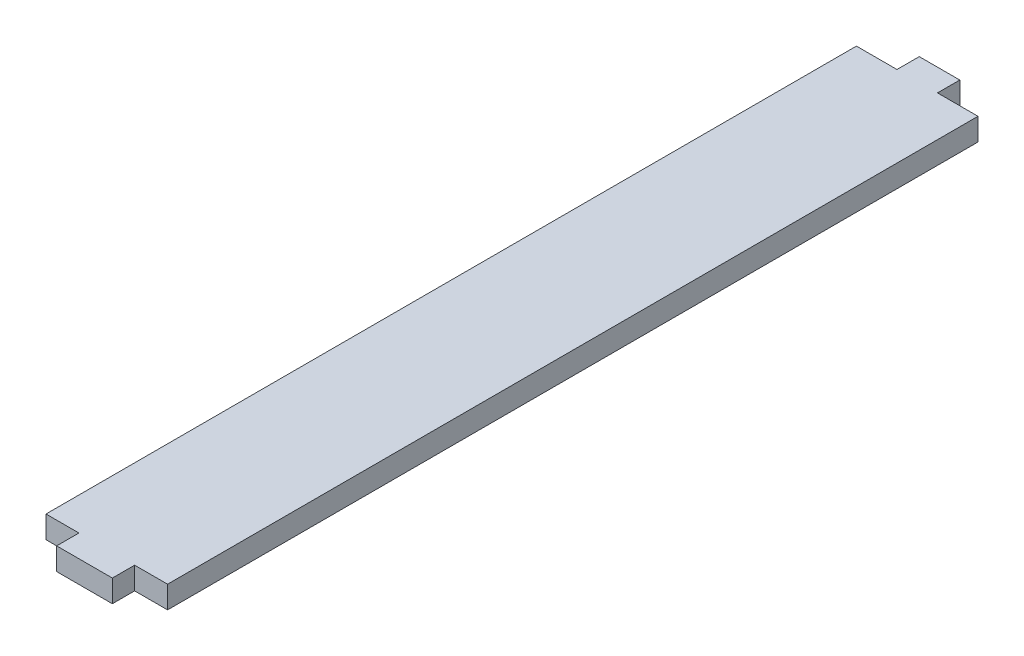
from build123d import *

# Parameters (mm, degrees)
BOSS_EXTRUDE1_DEPTH = 5.5


with BuildPart() as part:
    # Sketch1 → Boss-Extrude1 (new body)
    with BuildSketch(Plane(origin=(0, 0, 0), x_dir=(1, 0, 0), z_dir=(0, 1, 0))):
        Polygon((77.286101932, -31.56250034), (77.286101932, -37.06250034), (91.036101932, -37.06250034), (91.036101932, -31.56250034), (99.161101932, -31.56250034), (99.161101932, 168.43749966), (89.161101932, 168.43749966), (89.161101932, 173.93749966), (79.161101932, 173.93749966), (79.161101932, 168.43749966), (69.161101932, 168.43749966), (69.161101932, -31.56250034), align=None)
    extrude(amount=BOSS_EXTRUDE1_DEPTH)


solid = part.part
